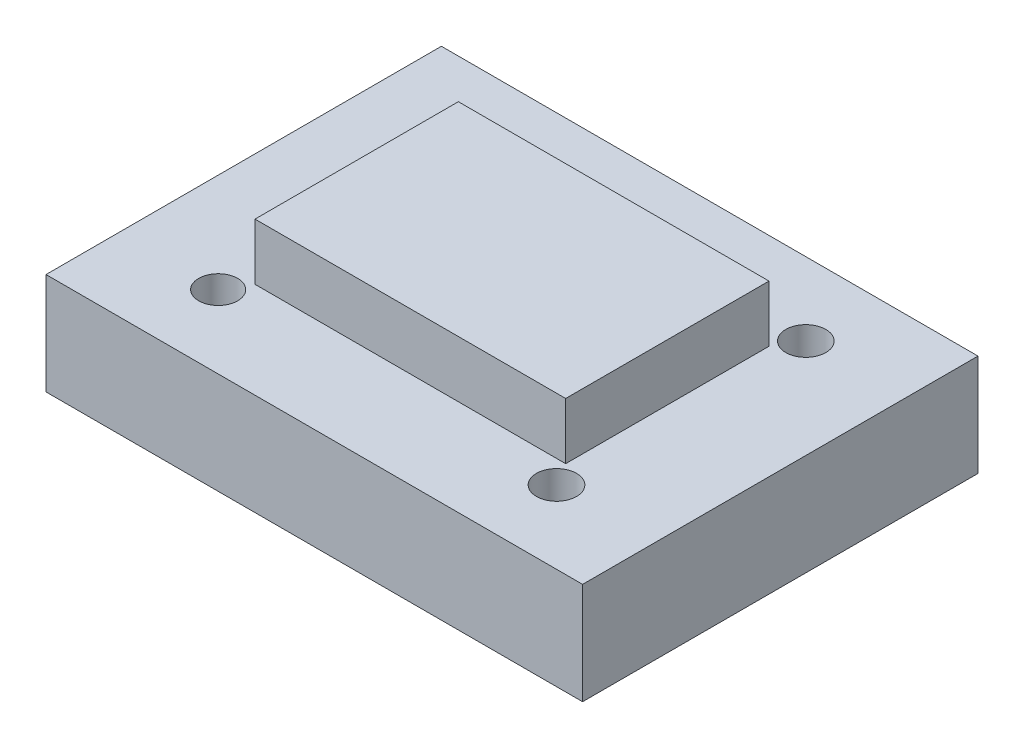
from build123d import *

# Parameters (mm, degrees)
F_01_BASE_PROFILE_W           = 95
F_01_BASE_PROFILE_H           = 70
F_01_BASE_PROFILE_R           = 3.450405227
F_01_BASE_PROFILE_R_2         = 3.5502693
F_01_BASE_PROFILE_W_2         = 25
F_01_BASE_PROFILE_H_2         = 28
F_01_BASE_EXTRUDE_DEPTH       = 18
F_02_BOSS_PROFILE_W           = 55
F_02_BOSS_PROFILE_H           = 36
F_02_REINFORCEMENT_BOSS_DEPTH = 28


with BuildPart() as part:
    # 01_Base_Profile → 01_Base_Extrude (new body)
    with BuildSketch(Plane(origin=(0, 0, 0), x_dir=(1, 0, 0), z_dir=(0, 1, 0))):
        Rectangle(F_01_BASE_PROFILE_W, F_01_BASE_PROFILE_H)
        with Locations((-29.9497307, -22.068222621)):
            Circle(F_01_BASE_PROFILE_R, mode=Mode.SUBTRACT)
        with Locations((29.9497307, -22.068222621)):
            Circle(F_01_BASE_PROFILE_R_2, mode=Mode.SUBTRACT)
        with Locations((-29.9497307, 22.068222621)):
            Circle(F_01_BASE_PROFILE_R, mode=Mode.SUBTRACT)
        with Locations((29.9497307, 22.068222621)):
            Circle(F_01_BASE_PROFILE_R_2, mode=Mode.SUBTRACT)
        Rectangle(F_01_BASE_PROFILE_W_2, F_01_BASE_PROFILE_H_2, mode=Mode.SUBTRACT)
    extrude(amount=F_01_BASE_EXTRUDE_DEPTH)

    # 02_Boss_Profile → 02_Reinforcement_Boss (add)
    with BuildSketch(Plane(origin=(0, 0, 0), x_dir=(1, 0, 0), z_dir=(0, 1, 0))):
        Rectangle(F_02_BOSS_PROFILE_W, F_02_BOSS_PROFILE_H)
    extrude(amount=F_02_REINFORCEMENT_BOSS_DEPTH)


solid = part.part
